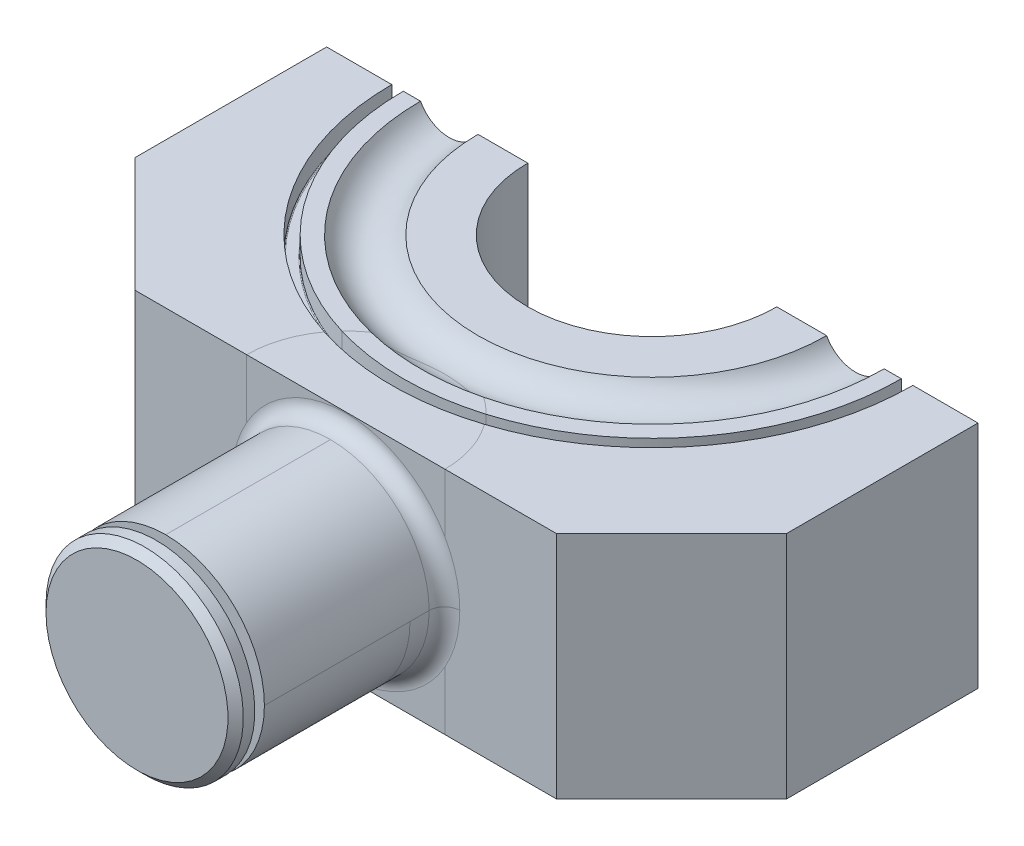
from build123d import *

# Parameters (mm, degrees)
MAIN_DEPTH                = 120
PERNO1_START              = 160
PERNO1_OUTLINE_R          = 51.5
PERNO1_DEPTH              = 94
PERNO1_2_OUTLINE_R        = 65
PERNO1_2_DEPTH            = 120
SANALATURAPERNO_START     = 254
SKETCH4_3_R               = 40
SANALATURAPERNO_DEPTH     = 5
PERNO2_START              = 259
SKETCH4_4_R               = 51.5
SKETCH4_4_R_2             = 40
PERNO2_DEPTH              = 10
CHAMFER1_SIZE             = 4
FILLET2_R                 = 8
CHAMFER1_OF_MIRROR14_SIZE = 4
FILLET2_OF_MIRROR14_R     = 8
CHAMFER2_SIZE             = 5
PISTA_R                   = 17
SKETCH9_W                 = 397.156797082
SKETCH9_H                 = 271.545663618
CUT_EXTRUDE4_DEPTH        = 120
FILLET3_R                 = 0.5


# Read off the part's stored shape, not the designer's step: Perno1
with BuildPart() as part:
    # MainBody → Main (new body)
    with BuildSketch(Plane(origin=(0, 0, 0), x_dir=(1, 0, 0), z_dir=(0, 1, 0))):
        Polygon((-110, 160), (110, 160), (170, 100), (170, -100), (110, -160), (-110, -160), (-170, -100), (-170, 100), align=None)
    extrude(amount=MAIN_DEPTH)

    # Perno1 outline → Perno1 (add)
    with BuildSketch(Plane.XY.offset(PERNO1_START)):
        with Locations((0, 60)):
            Circle(PERNO1_OUTLINE_R)
    perno1 = extrude(amount=PERNO1_DEPTH)

    # Perno1 2 outline → Perno1 2 (cut)
    with BuildSketch(Plane(origin=(0, 0, 0), x_dir=(1, 0, 0), z_dir=(0, 1, 0))):
        Circle(PERNO1_2_OUTLINE_R)
    perno1_2 = extrude(amount=PERNO1_2_DEPTH, mode=Mode.SUBTRACT)

    # Sketch4<3> → SanalaturaPerno (add)
    with BuildSketch(Plane.XY.offset(SANALATURAPERNO_START)):
        with Locations(Location((0, 60, 0), (0, 0, 180))):
            Circle(SKETCH4_3_R)
    sanalaturaperno = extrude(amount=SANALATURAPERNO_DEPTH)

    # Sketch4<4> → Perno2 (add)
    # profile 1 of 2: a face of its own
    with BuildSketch(Plane.XY.offset(PERNO2_START)):
        with Locations(Location((0, 60, 0), (0, 0, 180))):
            Circle(SKETCH4_4_R)
        with Locations(Location((0, 60, 0), (0, 0, 180))):
            Circle(SKETCH4_4_R_2, mode=Mode.SUBTRACT)
    # profile 2 of 2: a face of its own
    with BuildSketch(Plane.XY.offset(PERNO2_START)):
        with Locations(Location((0, 60, 0), (0, 0, 180))):
            Circle(SKETCH4_4_R_2)
    perno2 = extrude(amount=PERNO2_DEPTH)

    # Chamfer1
    chamfer1_edges = [part.edges().sort_by_distance(p)[0] for p in [
        (51.5, 60, 269),
    ]]
    chamfer(chamfer1_edges, length=CHAMFER1_SIZE)

    # Fillet2
    fillet2_edges = [part.edges().sort_by_distance(p)[0] for p in [
        (-51.5, 60, 160),
    ]]
    fillet(fillet2_edges, radius=FILLET2_R)

    # Mirror14: Perno1, Perno1 2, SanalaturaPerno, Perno2 across plane
    add(perno1.mirror(Plane.XY))
    add(perno1_2.mirror(Plane.XY), mode=Mode.SUBTRACT)
    add(sanalaturaperno.mirror(Plane.XY))
    add(perno2.mirror(Plane.XY))

    # Chamfer1 of Mirror14
    chamfer1_of_mirror14_edges = [part.edges().sort_by_distance(p)[0] for p in [
        (51.5, 60, -269),
    ]]
    chamfer(chamfer1_of_mirror14_edges, length=CHAMFER1_OF_MIRROR14_SIZE)

    # Fillet2 of Mirror14
    fillet2_of_mirror14_edges = [part.edges().sort_by_distance(p)[0] for p in [
        (-51.5, 60, -160),
    ]]
    fillet(fillet2_of_mirror14_edges, radius=FILLET2_OF_MIRROR14_R)

    # Chamfer2
    chamfer2_edges = [part.edges().sort_by_distance(p)[0] for p in [
        (-65, 0, 0),
    ]]
    chamfer(chamfer2_edges, length=CHAMFER2_SIZE)

    # Pista → PistaCut (revolve, cut)
    with BuildSketch(Plane.XY, mode=Mode.PRIVATE) as pistacut_sk:
        with Locations((106, 128)):
            Circle(PISTA_R)
    revolve(pistacut_sk.sketch.rotate(Axis((0, 120, 0), (0, -1, 0)), 90), axis=Axis((0, 120, 0), (0, -1, 0)), mode=Mode.SUBTRACT)

    # Sketch8 → Cut-Revolve2 (revolve, cut)
    with BuildSketch(Plane(origin=(0, 0, 0), x_dir=(0, 0, -1), z_dir=(1, 0, 0))):
        Polygon((-136, 141), (-136, 131), (-136, 120), (-136, 110), (-130, 110), (-130, 120), (-130, 124), (-130, 141), align=None)
    revolve(axis=Axis((0, 120, 0), (0, -1, 0)), mode=Mode.SUBTRACT)

    # Sketch9 → Cut-Extrude4 (cut)
    with BuildSketch(Plane(origin=(0, 0, 0), x_dir=(1, 0, 0), z_dir=(0, 1, 0))):
        with Locations((-21.107680821, 135.772831809)):
            Rectangle(SKETCH9_W, SKETCH9_H)
    extrude(amount=CUT_EXTRUDE4_DEPTH, mode=Mode.SUBTRACT)

    # Fillet3
    fillet3_edges = [part.edges().sort_by_distance(p)[0] for p in [
        (0, 110, 136),
        (0, 110, 136),
        (0, 110, 130),
        (0, 110, 130),
        (0, 110, 130),
        (0, 110, 136),
    ]]
    fillet(fillet3_edges, radius=FILLET3_R)


solid = part.part
